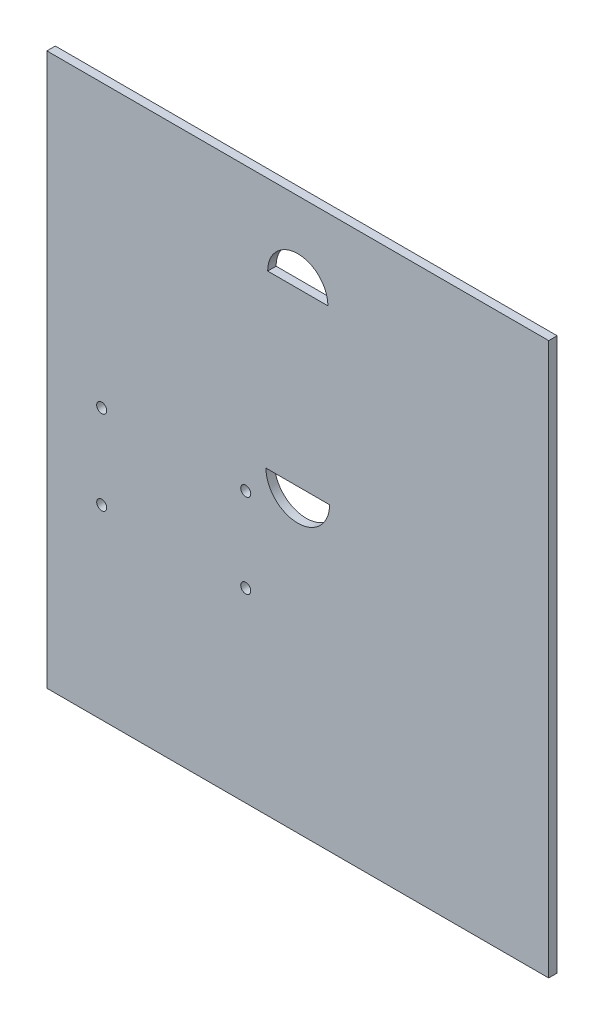
from build123d import *

# Parameters (mm, degrees)
SKETCH1_W               = 250
SKETCH1_H               = 275
BOSS_EXTRUDE1_DEPTH     = 4.2
ESQUISSE1_R             = 2.50000008
ENL_V_MAT_EXTRU_1_DEPTH = 276.146260086


with BuildPart() as part:
    # Sketch1 → Boss-Extrude1 (new body)
    with BuildSketch(Plane.XY):
        with Locations((-95.228215768, -27.385892116)):
            Rectangle(SKETCH1_W, SKETCH1_H)
    extrude(amount=BOSS_EXTRUDE1_DEPTH)

    # Esquisse1 → Enlèv. mat.-Extru.1 (cut, through all)
    with BuildSketch(Plane.XY.offset(4.2)):
        with Locations((-121.154620655, -72.13402695)):
            Circle(ESQUISSE1_R)
        with Locations((-121.154620655, -30.22402695)):
            Circle(ESQUISSE1_R)
        with Locations((-192.909620655, -72.13402695)):
            Circle(ESQUISSE1_R)
        with Locations((-192.909620655, -30.22402695)):
            Circle(ESQUISSE1_R)
        with BuildLine():
            Line((-110.228215768, 70.114107884), (-80.228215768, 70.114107884))
            ThreePointArc((-80.228215768, 70.114107884), (-95.228215768, 85.114107884), (-110.228215768, 70.114107884))
        make_face()
        with BuildLine():
            Line((-111.073893882, -15.305892116), (-79.382537653, -15.305892116))
            ThreePointArc((-79.382537653, -15.305892116), (-95.228215768, -31.151570231), (-111.073893882, -15.305892116))
        make_face()
    extrude(amount=-ENL_V_MAT_EXTRU_1_DEPTH, mode=Mode.SUBTRACT)


solid = part.part
